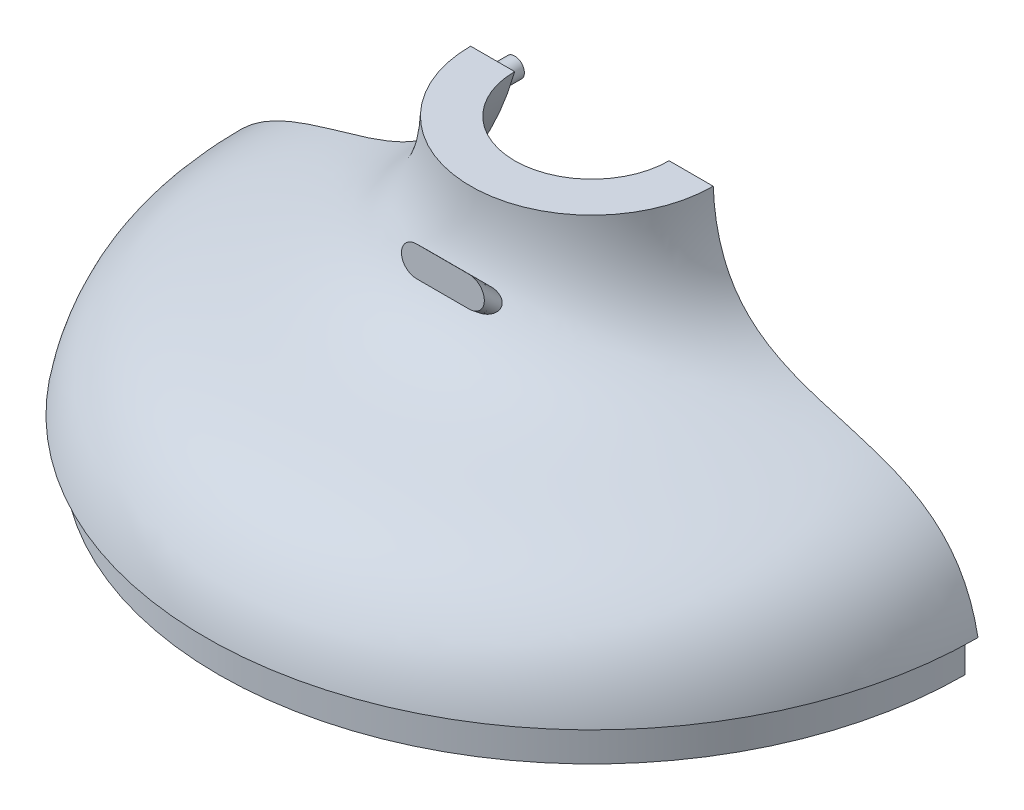
from build123d import *

# Parameters (mm, degrees)
R_VOLUTION1_ANGLE            = 90
ESQUISSE6_R                  = 3.75
BOSS_EXTRU_1_DEPTH           = 10
R_P_TITION_CIRCULAIRE2_COUNT = 2
R_P_TITION_CIRCULAIRE2_ANGLE = 270
R_P_TITION_CIRCULAIRE3_COUNT = 2
R_P_TITION_CIRCULAIRE3_ANGLE = 90


with BuildPart() as part:
    # Esquisse2 → Révolution1 (revolve)
    with BuildSketch(Plane.XY):
        with BuildLine():
            Line((30, 0), (47.131260288, 0))
            add(Edge.make_bspline(
                [(47.131260288, 0), (50.337430192, -76.684539626), (136.959304806, -31.563871951), (150, -100.45024926)],
                knots=[0, 0, 0, 0, 1, 1, 1, 1], degree=3))
            Line((150, -100.45024926), (145, -100.45024926))
            Line((145, -100.45024926), (145, -115.45024926))
            Line((145, -115.45024926), (135, -115.45024926))
            Line((135, -115.45024926), (135, -100.45024926))
            Line((135, -100.45024926), (130, -100.45024926))
            add(Edge.make_bspline(
                [(30, 0), (52.696130576, -79.217712587), (124.807660959, -82.686229226), (130, -100.45024926)],
                knots=[0, 0, 0, 0, 1, 1, 1, 1], degree=3))
        make_face()
    revolve(axis=Axis((0, 55, 0), (0, -1, 0)), revolution_arc=R_VOLUTION1_ANGLE)

    # Esquisse6 → Boss.-Extru.1 (add)
    with BuildSketch(Plane.ZY):
        with Locations(Location((40, -8.5, 0), (0, 0, 180))):
            Circle(ESQUISSE6_R)
        with Locations(Location((71.95431642, -52.883306602, 0), (0, 0, 180))):
            Circle(ESQUISSE6_R)
        with Locations(Location((125, -80, 0), (0, 0, 180))):
            Circle(ESQUISSE6_R)
    extrude(amount=BOSS_EXTRU_1_DEPTH)


with BuildPart() as r_p_tition_circulaire2_1:
    # Répétition circulaire2: pattern copy
    add(part.part.rotate(Axis((0, 55, 0), (0, -1, 0)), 1 * R_P_TITION_CIRCULAIRE2_ANGLE / (R_P_TITION_CIRCULAIRE2_COUNT - 1)))


with BuildPart() as part_1:
    add(part.part)

    # Combiner3: cut Répétition circulaire2_1
    add(r_p_tition_circulaire2_1.part, mode=Mode.SUBTRACT)


with BuildPart() as r_p_tition_circulaire3_1:
    # Répétition circulaire3: pattern copy
    add(part_1.part.rotate(Axis((0, 55, 0), (0, -1, 0)), 1 * R_P_TITION_CIRCULAIRE3_ANGLE / (R_P_TITION_CIRCULAIRE3_COUNT - 1)))


with BuildPart() as part_2:
    add(part_1.part)

    # Combiner4: union Répétition circulaire3_1
    add(r_p_tition_circulaire3_1.part)

    # Lissage2: read off the stored shape, not the designer's step
    # Lissage2: loft between two sections, ruled curve by curve
    lissage2_from = [
        Edge.make_bspline([(-10.141415638, -19.056019087, 58), (-8.212976489, -19.056019087, 58), (-4.745525631, -19.056019087, 58), (0.097340365, -19.056019087, 58), (4.940206361, -19.056019087, 58), (8.407657219, -19.056019087, 58), (10.992070669, -19.056019087, 58), (12.368530298, -19.277794454, 58), (14.347229759, -20.43033769, 58), (15.825485799, -22.4031348, 58), (16.381152507, -24.915194071, 58), (15.825485799, -27.427253342, 58), (14.347229759, -29.400050453, 58), (12.368530298, -30.552593688, 58), (10.992070669, -30.774369055, 58), (8.407657219, -30.774369055, 58), (4.940206361, -30.774369055, 58), (0.097340365, -30.774369055, 58), (-4.745525631, -30.774369055, 58), (-8.212976489, -30.774369055, 58), (-10.797389939, -30.774369055, 58), (-12.173849568, -30.552593688, 58), (-14.152549029, -29.400050453, 58), (-15.630805069, -27.427253342, 58), (-16.186471777, -24.915194071, 58), (-15.630805069, -22.4031348, 58), (-14.152549029, -20.43033769, 58), (-12.173849568, -19.277794454, 58), (-10.797389939, -19.056019087, 58), (-10.141415638, -19.056019087, 58)], [0, 0, 0, 0, 0.074390756, 0.148781511, 0.223172267, 0.297563023, 0.297563023, 0.322867645, 0.348172267, 0.373476889, 0.398781511, 0.424086134, 0.449390756, 0.474695378, 0.5, 0.5, 0.574390756, 0.648781511, 0.723172267, 0.797563023, 0.797563023, 0.822867645, 0.848172267, 0.873476889, 0.898781511, 0.924086134, 0.949390756, 0.974695378, 1, 1, 1, 1], 3),
    ]
    lissage2_to = [
        Edge.make_bspline([(-13.646593818, -29.959479994, 47), (-11.606942776, -29.959479994, 47), (-7.235758652, -29.959479994, 47), (0, -29.959479994, 47), (7.235758652, -29.959479994, 47), (11.606942776, -29.959479994, 47), (14.340397752, -29.959479994, 47), (15.598489603, -30.279278409, 47), (16.997996562, -31.3442136, 47), (17.857241012, -32.768726587, 47), (18.146490081, -34.362953291, 47), (17.857241012, -35.957179995, 47), (16.997996562, -37.381692982, 47), (15.598489603, -38.446628173, 47), (14.340397752, -38.766426588, 47), (11.606942776, -38.766426588, 47), (7.235758652, -38.766426588, 47), (0, -38.766426588, 47), (-7.235758652, -38.766426588, 47), (-11.606942776, -38.766426588, 47), (-14.340397752, -38.766426588, 47), (-15.598489603, -38.446628173, 47), (-16.997996562, -37.381692982, 47), (-17.857241012, -35.957179995, 47), (-18.146490081, -34.362953291, 47), (-17.857241012, -32.768726587, 47), (-16.997996562, -31.3442136, 47), (-15.598489603, -30.279278409, 47), (-14.340397752, -29.959479994, 47), (-13.646593818, -29.959479994, 47)], [0, 0, 0, 0, 0.074390756, 0.148781511, 0.223172267, 0.297563023, 0.297563023, 0.322867645, 0.348172267, 0.373476889, 0.398781511, 0.424086134, 0.449390756, 0.474695378, 0.5, 0.5, 0.574390756, 0.648781511, 0.723172267, 0.797563023, 0.797563023, 0.822867645, 0.848172267, 0.873476889, 0.898781511, 0.924086134, 0.949390756, 0.974695378, 1, 1, 1, 1], 3),
    ]
    lissage2 = Solid(Shell([*[Face.make_surface_from_curves(lissage2_from[k], lissage2_to[k]) for k in range(1)], Face(Wire(lissage2_from)), Face(Wire(lissage2_to))]))
    add(lissage2)

    # Lissage2 2: loft between two sections, ruled curve by curve
    lissage2_2_from = [
        Edge.make_bspline([(-10.141415638, -19.056019087, 58), (-8.212976489, -19.056019087, 58), (-4.745525631, -19.056019087, 58), (0.097340365, -19.056019087, 58), (4.940206361, -19.056019087, 58), (8.407657219, -19.056019087, 58), (10.992070669, -19.056019087, 58), (12.368530298, -19.277794454, 58), (14.347229759, -20.43033769, 58), (15.825485799, -22.4031348, 58), (16.381152507, -24.915194071, 58), (15.825485799, -27.427253342, 58), (14.347229759, -29.400050453, 58), (12.368530298, -30.552593688, 58), (10.992070669, -30.774369055, 58), (8.407657219, -30.774369055, 58), (4.940206361, -30.774369055, 58), (0.097340365, -30.774369055, 58), (-4.745525631, -30.774369055, 58), (-8.212976489, -30.774369055, 58), (-10.797389939, -30.774369055, 58), (-12.173849568, -30.552593688, 58), (-14.152549029, -29.400050453, 58), (-15.630805069, -27.427253342, 58), (-16.186471777, -24.915194071, 58), (-15.630805069, -22.4031348, 58), (-14.152549029, -20.43033769, 58), (-12.173849568, -19.277794454, 58), (-10.797389939, -19.056019087, 58), (-10.141415638, -19.056019087, 58)], [0, 0, 0, 0, 0.074390756, 0.148781511, 0.223172267, 0.297563023, 0.297563023, 0.322867645, 0.348172267, 0.373476889, 0.398781511, 0.424086134, 0.449390756, 0.474695378, 0.5, 0.5, 0.574390756, 0.648781511, 0.723172267, 0.797563023, 0.797563023, 0.822867645, 0.848172267, 0.873476889, 0.898781511, 0.924086134, 0.949390756, 0.974695378, 1, 1, 1, 1], 3),
    ]
    lissage2_2_to = [
        Edge.make_bspline([(-13.646593818, -29.959479994, 47), (-11.606942776, -29.959479994, 47), (-7.235758652, -29.959479994, 47), (0, -29.959479994, 47), (7.235758652, -29.959479994, 47), (11.606942776, -29.959479994, 47), (14.340397752, -29.959479994, 47), (15.598489603, -30.279278409, 47), (16.997996562, -31.3442136, 47), (17.857241012, -32.768726587, 47), (18.146490081, -34.362953291, 47), (17.857241012, -35.957179995, 47), (16.997996562, -37.381692982, 47), (15.598489603, -38.446628173, 47), (14.340397752, -38.766426588, 47), (11.606942776, -38.766426588, 47), (7.235758652, -38.766426588, 47), (0, -38.766426588, 47), (-7.235758652, -38.766426588, 47), (-11.606942776, -38.766426588, 47), (-14.340397752, -38.766426588, 47), (-15.598489603, -38.446628173, 47), (-16.997996562, -37.381692982, 47), (-17.857241012, -35.957179995, 47), (-18.146490081, -34.362953291, 47), (-17.857241012, -32.768726587, 47), (-16.997996562, -31.3442136, 47), (-15.598489603, -30.279278409, 47), (-14.340397752, -29.959479994, 47), (-13.646593818, -29.959479994, 47)], [0, 0, 0, 0, 0.074390756, 0.148781511, 0.223172267, 0.297563023, 0.297563023, 0.322867645, 0.348172267, 0.373476889, 0.398781511, 0.424086134, 0.449390756, 0.474695378, 0.5, 0.5, 0.574390756, 0.648781511, 0.723172267, 0.797563023, 0.797563023, 0.822867645, 0.848172267, 0.873476889, 0.898781511, 0.924086134, 0.949390756, 0.974695378, 1, 1, 1, 1], 3),
    ]
    lissage2_2 = Solid(Shell([*[Face.make_surface_from_curves(lissage2_2_from[k], lissage2_2_to[k]) for k in range(1)], Face(Wire(lissage2_2_from)), Face(Wire(lissage2_2_to))]))
    add(lissage2_2)


solid = part_2.part
